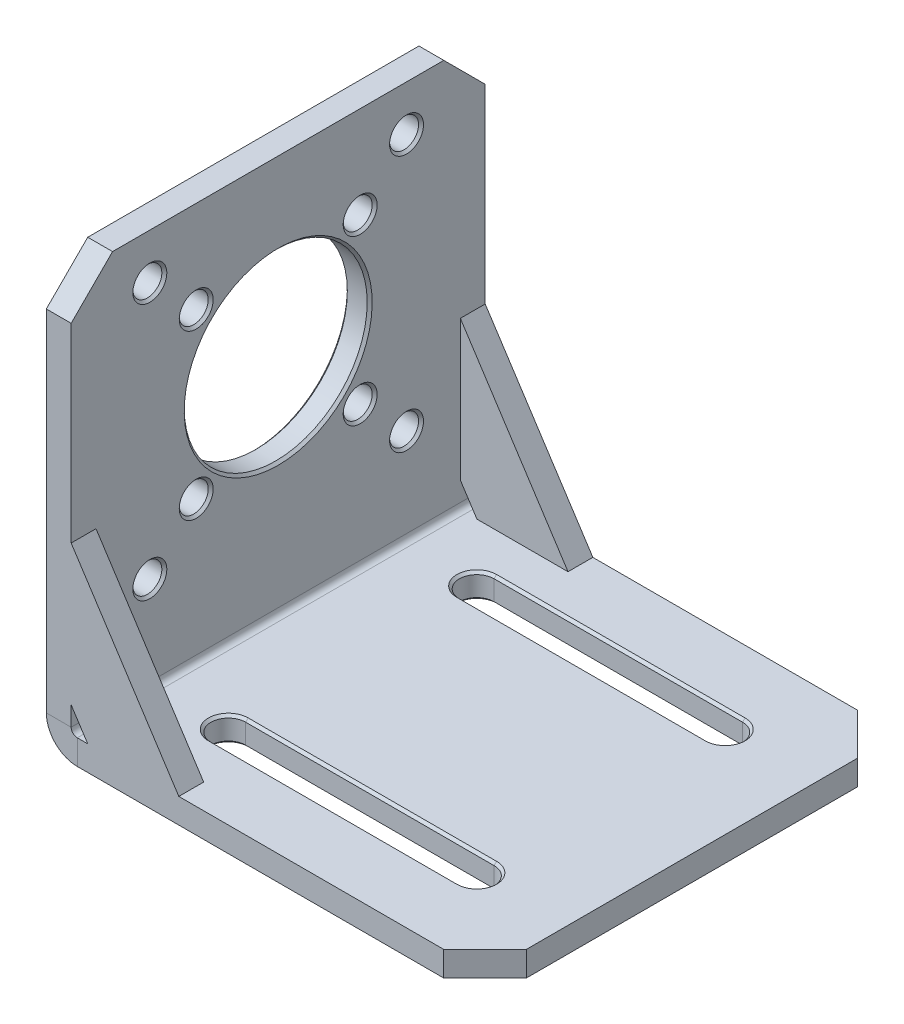
from build123d import *

# Parameters (mm, degrees)
SKETCH1_W                    = 100
SKETCH1_H                    = 50
BASE_FLANGE1_DEPTH           = 3
SKETCH2_R                    = 11.05
SKETCH2_R_2                  = 1.75
CUT_EXTRUDE1_DEPTH           = 104.121287812
SKETCH3_R                    = 1.75
CUT_EXTRUDE2_DEPTH           = 104.121287812
CIRPATTERN1_COUNT            = 4
CUT_EXTRUDE3_DEPTH           = 104.121287812
SKETCHED_BEND2_OUTLINE_W     = 3
SKETCHED_BEND2_OUTLINE_H     = 50
SKETCHED_BEND2_DEPTH         = 47.020021532
SKETCHED_START               = 47.383443248
SKETCHED_BEND2_2_OUTLINE_W   = 47.979978468
SKETCHED_BEND2_2_OUTLINE_H   = 50
SKETCHED_BEND2_2_OUTLINE_R   = 1.75
SKETCHED_BEND2_2_OUTLINE_R_2 = 11.05
SKETCHED_BEND2_2_DEPTH       = 2.636578284
SKETCHED_START_2             = 47.020021532
SKETCHED_BEND2_3_OUTLINE_W   = 47.979978468
SKETCHED_BEND2_3_OUTLINE_H   = 50
SKETCHED_BEND2_3_OUTLINE_R   = 1.75
SKETCHED_BEND2_3_OUTLINE_R_2 = 11.05
SKETCHED_BEND2_3_DEPTH       = 3.7366
SKETCHED_START_3             = -26
SKETCHED_BEND2_4_DEPTH       = 52
BOSS_EXTRUDE1_DEPTH          = 3
CHAMFER1_SIZE                = 5
CHAMFER2_SIZE                = 0.3
CHAMFER3_SIZE                = 0.3


with BuildPart() as part:
    # Base-Flange1: sheet metal written as solids
    # Sketch1 → Base-Flange1 (new body)
    with BuildSketch(Plane(origin=(0, 0, 0), x_dir=(1, 0, 0), z_dir=(0, 1, 0))):
        with Locations((50, 0)):
            Rectangle(SKETCH1_W, SKETCH1_H)
    extrude(amount=-BASE_FLANGE1_DEPTH)

    # Sketch2 → Cut-Extrude1 (cut, through all)
    with BuildSketch(Plane(origin=(0, 0, 0), x_dir=(1, 0, 0), z_dir=(0, 1, 0))):
        with Locations(Location((21, 0, 0), (0, 0, 270))):
            Circle(SKETCH2_R)
        with Locations(Location((5.5, 15.5, 0), (0, 0, 270))):
            Circle(SKETCH2_R_2)
        with Locations(Location((36.5, 15.5, 0), (0, 0, 270))):
            Circle(SKETCH2_R_2)
        with Locations(Location((36.5, -15.5, 0), (0, 0, 270))):
            Circle(SKETCH2_R_2)
        with Locations(Location((5.5, -15.5, 0), (0, 0, 270))):
            Circle(SKETCH2_R_2)
    extrude(amount=-CUT_EXTRUDE1_DEPTH, mode=Mode.SUBTRACT)

    # Sketch3 → Cut-Extrude2 (cut, through all)
    with BuildSketch(Plane(origin=(0, 0, 0), x_dir=(1, 0, 0), z_dir=(0, 1, 0))):
        with Locations(Location((11.100505063, 9.899494937, 0), (0, 0, 270))):
            Circle(SKETCH3_R)
    cut_extrude2 = extrude(amount=-CUT_EXTRUDE2_DEPTH, mode=Mode.SUBTRACT)

    # CirPattern1: Cut-Extrude2 ×4 about axis
    cirpattern1_axis = Axis((21, 0, 0), (0, 1, 0))
    for i in range(1, CIRPATTERN1_COUNT):
        add(cut_extrude2.rotate(cirpattern1_axis, i * 360 / CIRPATTERN1_COUNT), mode=Mode.SUBTRACT)

    # Sketch4 → Cut-Extrude3 (cut, through all)
    with BuildSketch(Plane(origin=(0, 0, 0), x_dir=(1, 0, 0), z_dir=(0, 1, 0))):
        with BuildLine():
            Line((59, 17.1), (89, 17.1))
            ThreePointArc((89, 17.1), (91.1, 15), (89, 12.9))
            Line((89, 12.9), (59, 12.9))
            ThreePointArc((59, 12.9), (56.9, 15), (59, 17.1))
        make_face()
        with BuildLine():
            Line((59, -12.9), (89, -12.9))
            ThreePointArc((89, -12.9), (91.1, -15), (89, -17.1))
            Line((89, -17.1), (59, -17.1))
            ThreePointArc((59, -17.1), (56.9, -15), (59, -12.9))
        make_face()
    extrude(amount=-CUT_EXTRUDE3_DEPTH, mode=Mode.SUBTRACT)

    # Sketched Bend2: read off the stored shape, not the designer's step
    # Sketched Bend2 outline → Sketched Bend2 (cut)
    with BuildSketch(Plane.YZ):
        with Locations((-1.5, 0)):
            Rectangle(SKETCHED_BEND2_OUTLINE_W, SKETCHED_BEND2_OUTLINE_H)
    extrude(amount=SKETCHED_BEND2_DEPTH, mode=Mode.SUBTRACT)

    # Sketched Bend2 2 outline → Sketched Bend2 2 (add)
    with BuildSketch(Plane.YZ.offset(SKETCHED_START)):
        with Locations((23.989989234, 0)):
            Rectangle(SKETCHED_BEND2_2_OUTLINE_W, SKETCHED_BEND2_2_OUTLINE_H)
        with Locations((11.479978468, -15.5)):
            Circle(SKETCHED_BEND2_2_OUTLINE_R, mode=Mode.SUBTRACT)
        with Locations((17.080483531, -9.899494937)):
            Circle(SKETCHED_BEND2_2_OUTLINE_R, mode=Mode.SUBTRACT)
        with Locations((42.479978468, -15.5)):
            Circle(SKETCHED_BEND2_2_OUTLINE_R, mode=Mode.SUBTRACT)
        with Locations((36.879473404, -9.899494937)):
            Circle(SKETCHED_BEND2_2_OUTLINE_R, mode=Mode.SUBTRACT)
        with Locations((17.080483531, 9.899494937)):
            Circle(SKETCHED_BEND2_2_OUTLINE_R, mode=Mode.SUBTRACT)
        with Locations((11.479978468, 15.5)):
            Circle(SKETCHED_BEND2_2_OUTLINE_R, mode=Mode.SUBTRACT)
        with Locations((26.979978468, 0)):
            Circle(SKETCHED_BEND2_2_OUTLINE_R_2, mode=Mode.SUBTRACT)
        with Locations((36.879473404, 9.899494937)):
            Circle(SKETCHED_BEND2_2_OUTLINE_R, mode=Mode.SUBTRACT)
        with Locations((42.479978468, 15.5)):
            Circle(SKETCHED_BEND2_2_OUTLINE_R, mode=Mode.SUBTRACT)
    extrude(amount=SKETCHED_BEND2_2_DEPTH)

    # Sketched Bend2 3 outline → Sketched Bend2 3 (add)
    with BuildSketch(Plane.YZ.offset(SKETCHED_START_2)):
        with Locations((23.989989234, 0)):
            Rectangle(SKETCHED_BEND2_3_OUTLINE_W, SKETCHED_BEND2_3_OUTLINE_H)
        with Locations((11.479978468, -15.5)):
            Circle(SKETCHED_BEND2_3_OUTLINE_R, mode=Mode.SUBTRACT)
        with Locations((17.080483531, -9.899494937)):
            Circle(SKETCHED_BEND2_3_OUTLINE_R, mode=Mode.SUBTRACT)
        with Locations((42.479978468, -15.5)):
            Circle(SKETCHED_BEND2_3_OUTLINE_R, mode=Mode.SUBTRACT)
        with Locations((36.879473404, -9.899494937)):
            Circle(SKETCHED_BEND2_3_OUTLINE_R, mode=Mode.SUBTRACT)
        with Locations((17.080483531, 9.899494937)):
            Circle(SKETCHED_BEND2_3_OUTLINE_R, mode=Mode.SUBTRACT)
        with Locations((11.479978468, 15.5)):
            Circle(SKETCHED_BEND2_3_OUTLINE_R, mode=Mode.SUBTRACT)
        with Locations((26.979978468, 0)):
            Circle(SKETCHED_BEND2_3_OUTLINE_R_2, mode=Mode.SUBTRACT)
        with Locations((36.879473404, 9.899494937)):
            Circle(SKETCHED_BEND2_3_OUTLINE_R, mode=Mode.SUBTRACT)
        with Locations((42.479978468, 15.5)):
            Circle(SKETCHED_BEND2_3_OUTLINE_R, mode=Mode.SUBTRACT)
    extrude(amount=SKETCHED_BEND2_3_DEPTH)

    # Sketched Bend2 4 outline → Sketched Bend2 4 (cut)
    with BuildSketch(Plane.XY.offset(SKETCHED_START_3)):
        with BuildLine():
            Line((50.756621532, 47.979978468), (50.020021532, 47.979978468))
            Line((50.020021532, 47.979978468), (50.020021532, 0.7366))
            ThreePointArc((50.020021532, 0.7366), (50.235766677, 0.215745145), (50.756621532, 0))
            Line((50.756621532, 0), (50.756621532, 47.979978468))
        make_face()
        with BuildLine():
            ThreePointArc((50.756621532, -3), (48.114446333, -1.905575198), (47.020021532, 0.7366))
            Line((47.020021532, 0.7366), (47.020021532, -3))
            Line((47.020021532, -3), (50.756621532, -3))
        make_face()
    extrude(amount=SKETCHED_BEND2_4_DEPTH, mode=Mode.SUBTRACT)

    # Sketch6 → Boss-Extrude1 (add)
    with BuildSketch(Plane.XY.offset(25)):
        Polygon((50.020021532, 20), (63.020021532, 0), (52.020021532, 0), (50.020021532, 3.076923077), align=None)
    boss_extrude1 = extrude(amount=-BOSS_EXTRUDE1_DEPTH)

    # Mirror1: Boss-Extrude1 across plane
    add(boss_extrude1.mirror(Plane.XY))

    # Chamfer1
    chamfer1_edges = [part.edges().sort_by_distance(p)[0] for p in [
        (100, -1.5, -25),
        (100, -1.5, 25),
        (48.520021532, 47.979978468, -25),
        (48.520021532, 47.979978468, 25),
    ]]
    chamfer(chamfer1_edges, length=CHAMFER1_SIZE)

    # Chamfer2
    chamfer2_edges = [part.edges().sort_by_distance(p)[0] for p in [
        (74, 0, -17.1),
        (91.1, 0, -15),
        (74, 0, -12.9),
        (56.9, 0, -15),
        (74, 0, 12.9),
        (91.1, 0, 15),
        (74, 0, 17.1),
        (56.9, 0, 15),
        (56.9, -3, 15),
        (74, -3, 17.1),
        (91.1, -3, 15),
        (74, -3, 12.9),
        (56.9, -3, -15),
        (74, -3, -12.9),
        (91.1, -3, -15),
        (74, -3, -17.1),
        (47.020021532, 15.929978468, 0),
        (50.020021532, 15.929978468, 0),
        (47.020021532, 40.729978468, -15.5),
        (50.020021532, 40.729978468, -15.5),
        (47.020021532, 9.729978468, -15.5),
        (50.020021532, 9.729978468, -15.5),
        (47.020021532, 9.729978468, 15.5),
        (50.020021532, 9.729978468, 15.5),
        (47.020021532, 40.729978468, 15.5),
        (50.020021532, 40.729978468, 15.5),
    ]]
    chamfer(chamfer2_edges, length=CHAMFER2_SIZE)

    # Chamfer3
    chamfer3_edges = [part.edges().sort_by_distance(p)[0] for p in [
        (47.020021532, 35.129473404, -9.899494937),
        (50.020021532, 35.129473404, -9.899494937),
        (47.020021532, 35.129473404, 9.899494937),
        (50.020021532, 35.129473404, 9.899494937),
        (47.020021532, 15.330483531, 9.899494937),
        (50.020021532, 15.330483531, 9.899494937),
        (47.020021532, 15.330483531, -9.899494937),
        (50.020021532, 15.330483531, -9.899494937),
    ]]
    chamfer(chamfer3_edges, length=CHAMFER3_SIZE)


solid = part.part
